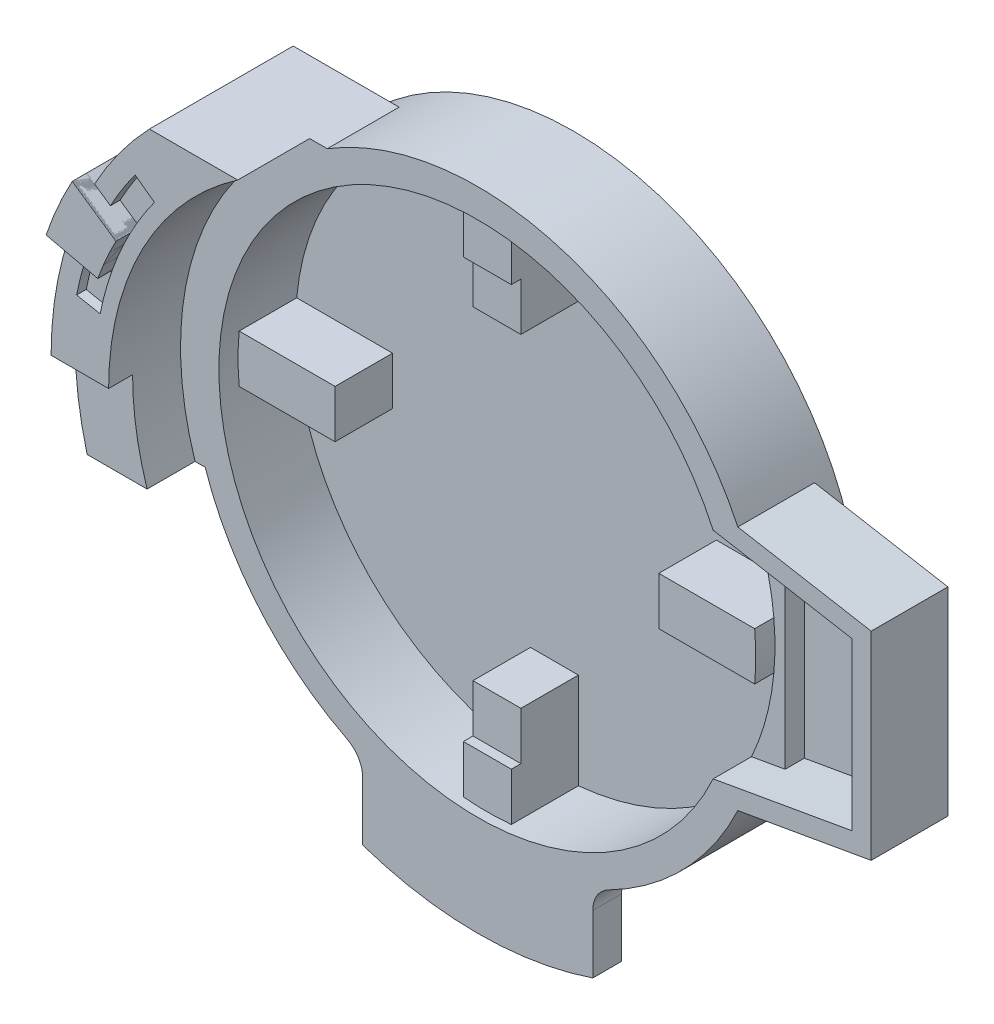
from build123d import *

# Parameters (mm, degrees)
SKETCH_1_R           = 30
EXTRUDE_1_DEPTH      = 2
SKETCH_5_R           = 30
SKETCH_5_R_2         = 27
EXTRUDE_2_DEPTH      = 10
EXTRUDE_START        = -3
EXTRUDE_3_DEPTH      = 3
FILLET_2_R           = 3
FILLET_3_R           = 3
EXTRUDE_START_2      = -6
EXTRUDE_4_DEPTH      = 6
EXTRUDE_6_DEPTH      = 7.5
SKETCH_14_R          = 31
CUT_EXTRUDE_3_DEPTH  = 7.5
CHAMFER_4_SIZE       = 2.644904711
CHAMFER_4_SIZE_2     = 15
CHAMFER_5_SIZE       = 2.644904711
CHAMFER_5_SIZE_2     = 15
CUT_EXTRUDE_START    = -4
CUT_EXTRUDE_6_DEPTH  = 4
EXTRUDE_10_DEPTH     = 5
CUT_EXTRUDE_START_2  = 6
CUT_EXTRUDE_7_DEPTH  = 6
EXTRUDE_11_DEPTH     = 8
EXTRUDE_12_DEPTH     = 1
EXTRUDE_13_DEPTH     = 1.5
EXTRUDE_14_DEPTH     = 16.5
CUT_EXTRUDE_START_3  = -1
CUT_EXTRUDE_8_DEPTH  = 1
EXTRUDE_START_3      = 2
EXTRUDE_15_DEPTH     = 2
CUT_EXTRUDE_9_DEPTH  = 2
SKETCH_33_R          = 30
CUT_EXTRUDE_10_DEPTH = 2
SKETCH_34_R          = 30
EXTRUDE_16_DEPTH     = 2


with BuildPart() as part:
    # 草图1 → 凸台-拉伸1 (new body)
    with BuildSketch(Plane.XY):
        Circle(SKETCH_1_R)
    extrude(amount=EXTRUDE_1_DEPTH)

    # 草图5 → 凸台-拉伸2 (add)
    with BuildSketch(Plane.XY.offset(2)):
        Circle(SKETCH_5_R)
        Circle(SKETCH_5_R_2, mode=Mode.SUBTRACT)
    extrude(amount=EXTRUDE_2_DEPTH)

    # 草图6 → 凸台-拉伸3 (add)
    with BuildSketch(Plane.XY.offset(12).offset(EXTRUDE_START)):
        with BuildLine():
            Line((-12, -27.49545417), (-12, -35.49545417))
            ThreePointArc((-12, -35.49545417), (0, -37.469017424), (12, -35.49545417))
            Line((12, -35.49545417), (12, -27.49545417))
            ThreePointArc((12, -27.49545417), (0, -30), (-12, -27.49545417))
        make_face()
    extrude(amount=EXTRUDE_3_DEPTH)

    # 圆角2
    fillet_2_edges = [part.edges().sort_by_distance(p)[0] for p in [
        (-12, -27.49545417, 10.5),
    ]]
    fillet(fillet_2_edges, radius=FILLET_2_R)

    # 圆角3
    fillet_3_edges = [part.edges().sort_by_distance(p)[0] for p in [
        (12, -27.49545417, 10.5),
    ]]
    fillet(fillet_3_edges, radius=FILLET_3_R)

    # 草图8 → 凸台-拉伸4 (add)
    with BuildSketch(Plane.XY.offset(12).offset(EXTRUDE_START_2)):
        with BuildLine():
            Line((27.037011669, -13), (41.037011669, -13))
            Line((41.037011669, -13), (41.037011669, 13))
            Line((41.037011669, 13), (27.037011669, 13))
            ThreePointArc((27.037011669, 13), (30, 0), (27.037011669, -13))
        make_face()
    extrude(amount=EXTRUDE_4_DEPTH)

    # 草图13 → 凸台-拉伸6 (add, symmetric)
    with BuildSketch(Plane.XY.offset(12)):
        with BuildLine():
            Line((-26.746575291, 25.566006927), (-15.696473801, 25.566006927))
            ThreePointArc((-15.696473801, 25.566006927), (-26.181044804, 14.647624141), (-30, 0))
            Line((-30, 0), (-37, 0))
            ThreePointArc((-37, 0), (-34.341107188, 13.772739637), (-26.746575291, 25.566006927))
        make_face()
    extrude(amount=EXTRUDE_6_DEPTH, both=True)

    # 草图14 → 切除-拉伸3 (cut)
    with BuildSketch(Plane.XY.offset(19.5)):
        Circle(SKETCH_14_R)
    extrude(amount=-CUT_EXTRUDE_3_DEPTH, mode=Mode.SUBTRACT)

    # 倒角4
    # the kernel refuses this chamfer: 15, 2.644904711 mm, written as the material it takes off along each edge
    with BuildSketch(Plane(origin=(41.037011669, 13, -32.978081946), x_dir=(0.21013876076743002, -0.9776715712462589, 0), z_dir=(0, 0, 1))) as chamfer_4_piece_1_section:
        Polygon((CHAMFER_4_SIZE * 0.977671571108, -CHAMFER_4_SIZE * 0.210138760738), (-CHAMFER_4_SIZE_2 * 0.210138760767, -CHAMFER_4_SIZE_2 * 0.977671571246), (0, 0), align=None)
    chamfer_4_piece_1 = extrude(amount=83.956163893, mode=Mode.PRIVATE)
    chamfer_4_piece_1 = chamfer_4_piece_1 - Plane(origin=(0, 0, 9), x_dir=(1, 0, 0), z_dir=(0, 0, -1)) * Cylinder(30, 227, mode=Mode.PRIVATE)
    add(chamfer_4_piece_1, mode=Mode.SUBTRACT)

    # 倒角5
    # the kernel refuses this chamfer: 15, 2.644904711 mm, written as the material it takes off along each edge
    with BuildSketch(Plane(origin=(41.037011669, -13, -32.978081946), x_dir=(0.21013876076743015, 0.9776715712462588, 0), z_dir=(0, 0, 1))) as chamfer_5_piece_1_section:
        Polygon((CHAMFER_5_SIZE * 0.977671571108, CHAMFER_5_SIZE * 0.210138760738), (-CHAMFER_5_SIZE_2 * 0.210138760767, CHAMFER_5_SIZE_2 * 0.977671571246), (0, 0), align=None)
    chamfer_5_piece_1 = extrude(amount=83.956163893, mode=Mode.PRIVATE)
    chamfer_5_piece_1 = chamfer_5_piece_1 - Plane(origin=(0, 0, 9), x_dir=(1, 0, 0), z_dir=(0, 0, -1)) * Cylinder(30, 227, mode=Mode.PRIVATE)
    add(chamfer_5_piece_1, mode=Mode.SUBTRACT)

    # 草图16 → 切除-拉伸6 (cut)
    with BuildSketch(Plane.XY.offset(12).offset(CUT_EXTRUDE_START)):
        with BuildLine():
            ThreePointArc((27, 0), (26.381265258, 5.747072595), (24.553419007, 11.230744191))
            Line((24.553419007, 11.230744191), (18.452318659, 12.306532794))
            Line((18.452318659, 12.306532794), (21.994315515, -11.681983183))
            Line((21.994315515, -11.681983183), (24.553419007, -11.230744191))
            ThreePointArc((24.553419007, -11.230744191), (26.381265258, -5.747072595), (27, 0))
        make_face()
        with BuildLine():
            Line((18.452318659, 12.306532794), (24.553419007, 11.230744191))
            ThreePointArc((24.553419007, 11.230744191), (-27, 0), (24.553419007, -11.230744191))
            Line((24.553419007, -11.230744191), (21.994315515, -11.681983183))
            Line((21.994315515, -11.681983183), (18.452318659, 12.306532794))
        make_face()
        with BuildLine():
            Line((39.037011669, 8.676896027), (27.995789134, 10.62376146))
            Line((27.995789134, 10.62376146), (24.553419007, 11.230744191))
            ThreePointArc((24.553419007, 11.230744191), (26.381265258, 5.747072595), (27, 0))
            ThreePointArc((27, 0), (26.381265258, -5.747072595), (24.553419007, -11.230744191))
            Line((24.553419007, -11.230744191), (39.037011669, -8.676896027))
            Line((39.037011669, -8.676896027), (39.037011669, 8.676896027))
        make_face()
    extrude(amount=CUT_EXTRUDE_6_DEPTH, mode=Mode.SUBTRACT)

    # 草图17 → 凸台-拉伸10 (add, symmetric)
    with BuildSketch(Plane.XY.offset(12)):
        with BuildLine():
            Line((-28.430518618, -9.576304669), (-35.739255573, -9.576304669))
            ThreePointArc((-35.739255573, -9.576304669), (-36.683459871, -4.829469112), (-37, 0))
            Line((-37, 0), (-31, 0))
            Line((-31, 0), (-30, 0))
            ThreePointArc((-30, 0), (-29.605029628, -4.852032639), (-28.430518618, -9.576304669))
        make_face()
    extrude(amount=EXTRUDE_10_DEPTH, both=True)

    # 草图18 → 切除-拉伸7 (cut)
    with BuildSketch(Plane.XY.offset(12).offset(CUT_EXTRUDE_START_2)):
        with BuildLine():
            ThreePointArc((-31, 0), (-30.618603506, -4.847795306), (-29.483798753, -9.576304669))
            Line((-29.483798753, -9.576304669), (-28.430518618, -9.576304669))
            ThreePointArc((-28.430518618, -9.576304669), (-29.605029628, -4.852032639), (-30, 0))
            Line((-30, 0), (-31, 0))
        make_face()
    extrude(amount=-CUT_EXTRUDE_7_DEPTH, mode=Mode.SUBTRACT)

    # 草图19 → 凸台-拉伸11 (add)
    with BuildSketch(Plane.XY.offset(2)):
        with BuildLine():
            Line((-2.5, 26.884010118), (-2.5, 16.884010118))
            Line((-2.5, 16.884010118), (2.5, 16.884010118))
            Line((2.5, 16.884010118), (2.5, 26.884010118))
            ThreePointArc((2.5, 26.884010118), (0, 27), (-2.5, 26.884010118))
        make_face()
        with BuildLine():
            Line((26.884010118, 2.5), (16.884010118, 2.5))
            Line((16.884010118, 2.5), (16.884010118, -2.5))
            Line((16.884010118, -2.5), (26.884010118, -2.5))
            ThreePointArc((26.884010118, -2.5), (27, 0), (26.884010118, 2.5))
        make_face()
        with BuildLine():
            Line((2.5, -26.884010118), (2.5, -16.884010118))
            Line((2.5, -16.884010118), (-2.5, -16.884010118))
            Line((-2.5, -16.884010118), (-2.5, -26.884010118))
            ThreePointArc((-2.5, -26.884010118), (0, -27), (2.5, -26.884010118))
        make_face()
        with BuildLine():
            Line((-26.884010118, -2.5), (-16.884010118, -2.5))
            Line((-16.884010118, -2.5), (-16.884010118, 2.5))
            Line((-16.884010118, 2.5), (-26.884010118, 2.5))
            ThreePointArc((-26.884010118, 2.5), (-27, 0), (-26.884010118, -2.5))
        make_face()
    extrude(amount=EXTRUDE_11_DEPTH)

    # 草图20 → 凸台-拉伸12 (add)
    with BuildSketch(Plane.XY.offset(10)):
        with BuildLine():
            ThreePointArc((2.5, -26.884010118), (0, -27), (-2.5, -26.884010118))
            Line((-2.5, -26.884010118), (-2.5, -21.884010118))
            Line((-2.5, -21.884010118), (2.5, -21.884010118))
            Line((2.5, -21.884010118), (2.5, -26.884010118))
        make_face()
        with BuildLine():
            ThreePointArc((2.5, 26.884010118), (0, 27), (-2.5, 26.884010118))
            Line((-2.5, 26.884010118), (-2.5, 21.884010118))
            Line((-2.5, 21.884010118), (2.5, 21.884010118))
            Line((2.5, 21.884010118), (2.5, 26.884010118))
        make_face()
    extrude(amount=EXTRUDE_12_DEPTH)

    # 草图21 → 凸台-拉伸13 (add)
    with BuildSketch(Plane.XY.offset(19.5)):
        with BuildLine():
            Line((-28.734434843, 15.184935109), (-33.295866493, 18.31352709))
            ThreePointArc((-33.295866493, 18.31352709), (-34.796265088, 15.271540063), (-36.019428995, 12.10787904))
            Line((-36.019428995, 12.10787904), (-30.628781703, 10.868658214))
            ThreePointArc((-30.628781703, 10.868658214), (-29.759963562, 13.061185581), (-28.734434843, 15.184935109))
        make_face()
    extrude(amount=EXTRUDE_13_DEPTH)

    # 草图28 → 切除-拉伸8 (cut)
    with BuildSketch(Plane.XY.offset(19.5).offset(CUT_EXTRUDE_START_3)):
        with BuildLine():
            Line((-34.336052546, 6.784946244), (-31.883477364, 6.300307226))
            ThreePointArc((-31.883477364, 6.300307226), (-31.339481347, 8.60737526), (-30.628781703, 10.868658214))
            Line((-30.628781703, 10.868658214), (-33.080272788, 11.432215546))
            ThreePointArc((-33.080272788, 11.432215546), (-33.788156333, 9.130196691), (-34.336052546, 6.784946244))
        make_face()
        with BuildLine():
            ThreePointArc((-28.734434843, 15.184935109), (-27.551258788, 17.238855508), (-26.22152974, 19.201077524))
            Line((-26.22152974, 19.201077524), (-28.23857049, 20.678083487))
            ThreePointArc((-28.23857049, 20.678083487), (-29.593761465, 18.687142166), (-30.80882562, 16.607717))
            Line((-30.80882562, 16.607717), (-28.734434843, 15.184935109))
        make_face()
    extrude(amount=CUT_EXTRUDE_8_DEPTH, mode=Mode.SUBTRACT)

    # 草图31 → 凸台-拉伸15 (add)
    with BuildSketch(Plane(origin=(0, 0, 6), x_dir=(-1, 0, 0), z_dir=(0, 0, -1)).offset(EXTRUDE_START_3)):
        with BuildLine():
            Line((-41.037011669, 10.355095289), (-41.037011669, -10.355095289))
            Line((-41.037011669, -10.355095289), (-27.128728731, -12.807500827))
            ThreePointArc((-27.128728731, -12.807500827), (-30, 0), (-27.128728731, 12.807500827))
            Line((-27.128728731, 12.807500827), (-41.037011669, 10.355095289))
        make_face()
    extrude(amount=-EXTRUDE_15_DEPTH)

    # 草图32 → 切除-拉伸9 (cut)
    with BuildSketch(Plane.XY.offset(8)):
        Polygon((39.037011669, -8.676896027), (28.060239243, -10.612397167), (28.060239243, 10.612397167), (39.037011669, 8.676896027), align=None)
    extrude(amount=-CUT_EXTRUDE_9_DEPTH, mode=Mode.SUBTRACT)

    # 草图33 → 切除-拉伸10 (cut)
    with BuildSketch(Plane(origin=(0, 0, 0), x_dir=(-1, 0, 0), z_dir=(0, 0, -1))):
        Circle(SKETCH_33_R)
    extrude(amount=-CUT_EXTRUDE_10_DEPTH, mode=Mode.SUBTRACT)

    # 草图34 → 凸台-拉伸16 (add)
    with BuildSketch(Plane(origin=(0, 0, 2), x_dir=(-1, 0, 0), z_dir=(0, 0, -1))):
        Circle(SKETCH_34_R)
    extrude(amount=-EXTRUDE_16_DEPTH)


with BuildPart() as body_2:
    # 草图26 → 凸台-拉伸14 (new body)
    with BuildSketch(Plane.XY.offset(21)):
        with BuildLine():
            Line((-28.734434843, 15.184935109), (-33.295866493, 18.31352709))
            ThreePointArc((-33.295866493, 18.31352709), (-34.796265088, 15.271540063), (-36.019428995, 12.10787904))
            Line((-36.019428995, 12.10787904), (-30.628781703, 10.868658214))
            ThreePointArc((-30.628781703, 10.868658214), (-29.759963562, 13.061185581), (-28.734434843, 15.184935109))
        make_face()
    extrude(amount=-EXTRUDE_14_DEPTH)


solid = Compound([part.part, body_2.part])
